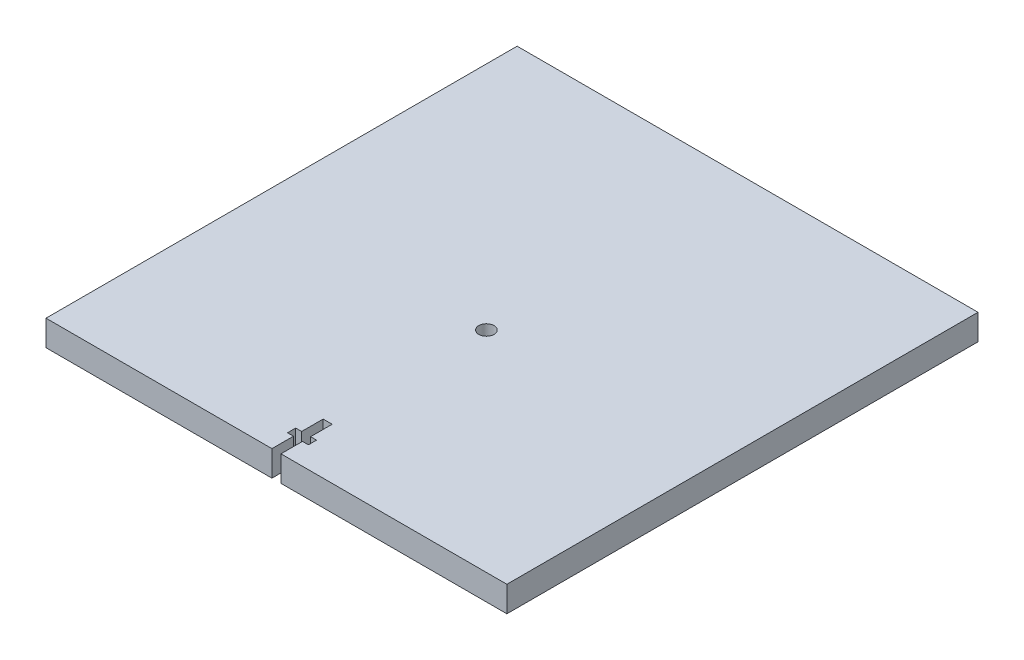
from build123d import *

# Parameters (mm, degrees)
SKETCH1_W                      = 142.875
SKETCH1_H                      = 146.05
BOSS_EXTRUDE1_DEPTH            = 7.9375
CUT_EXTRUDE2_DEPTH             = 205.467288414
F_3_16_0_1875_DIAMETER_HOLE1_D = 4.7625


with BuildPart() as part:
    # Sketch1 → Boss-Extrude1 (new body)
    with BuildSketch(Plane(origin=(0, 0, 0), x_dir=(1, 0, 0), z_dir=(0, 1, 0))):
        with Locations((71.4375, 73.025)):
            Rectangle(SKETCH1_W, SKETCH1_H)
    extrude(amount=BOSS_EXTRUDE1_DEPTH)

    # Sketch10 → Cut-Extrude2 (cut, through all)
    with BuildSketch(Plane(origin=(0, 7.9375, 0), x_dir=(1, 0, 0), z_dir=(0, 1, 0))):
        Polygon((70.0405, 9.2075), (68.199, 9.2075), (68.199, 6.6675), (70.0405, 6.6675), (70.0405, 0), (72.8345, 0), (72.8345, 6.6675), (74.676, 6.6675), (74.676, 9.2075), (72.8345, 9.2075), (72.8345, 15.875), (70.0405, 15.875), align=None)
    extrude(amount=-CUT_EXTRUDE2_DEPTH, mode=Mode.SUBTRACT)

    # 3/16 (0.1875) Diameter Hole1 (through all)
    with Locations(Plane(origin=(0, 0, 0), x_dir=(-1, 0, 0), z_dir=(0, -1, 0))):
        with Locations((-71.4375, 65.0875)):
            Hole(F_3_16_0_1875_DIAMETER_HOLE1_D / 2)


solid = part.part
